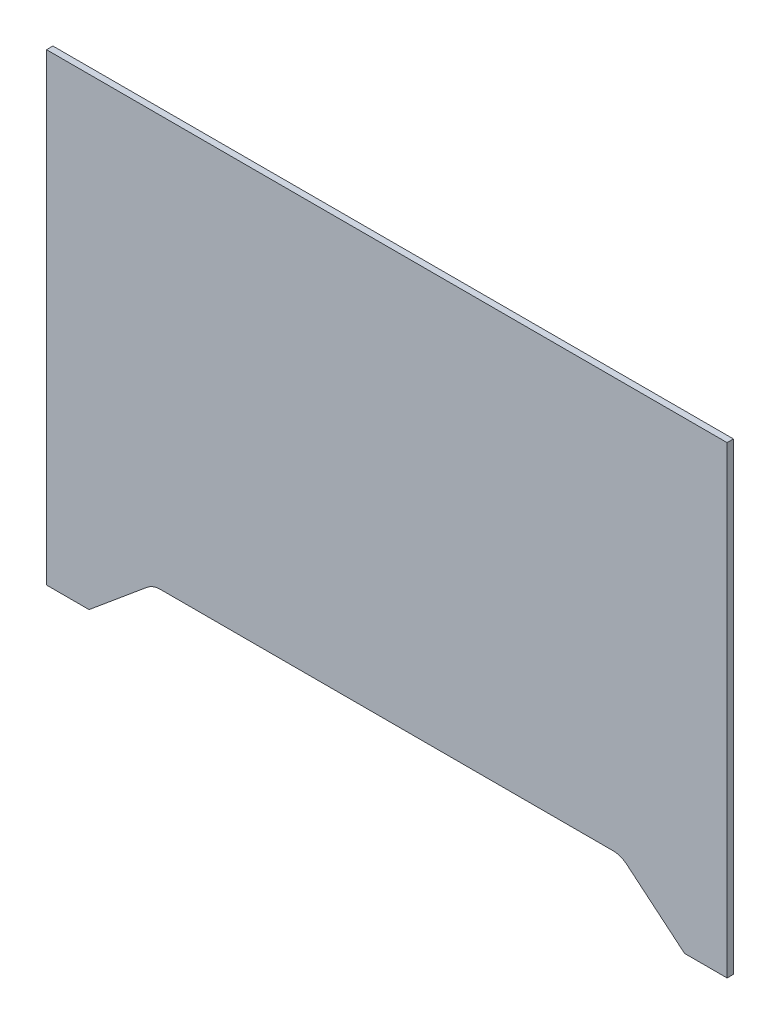
from build123d import *

# Parameters (mm, degrees)
BOSS_EXTRUDE1_DEPTH = 3


with BuildPart() as part:
    # Sketch1 → Boss-Extrude1 (new body)
    with BuildSketch(Plane.XY):
        with BuildLine():
            Line((-160, -109), (-160, 109))
            Line((-160, 109), (160, 109))
            Line((160, 109), (160, -109))
            Line((160, -109), (140, -109))
            Line((140, -109), (112.781344645, -86.317787204))
            ThreePointArc((112.781344645, -86.317787204), (109.783753286, -84.597284223), (106.379500648, -84))
            Line((106.379500648, -84), (-106.379500648, -84))
            ThreePointArc((-106.379500648, -84), (-109.783753286, -84.597284223), (-112.781344645, -86.317787204))
            Line((-112.781344645, -86.317787204), (-140, -109))
            Line((-140, -109), (-160, -109))
        make_face()
    extrude(amount=BOSS_EXTRUDE1_DEPTH)


solid = part.part
